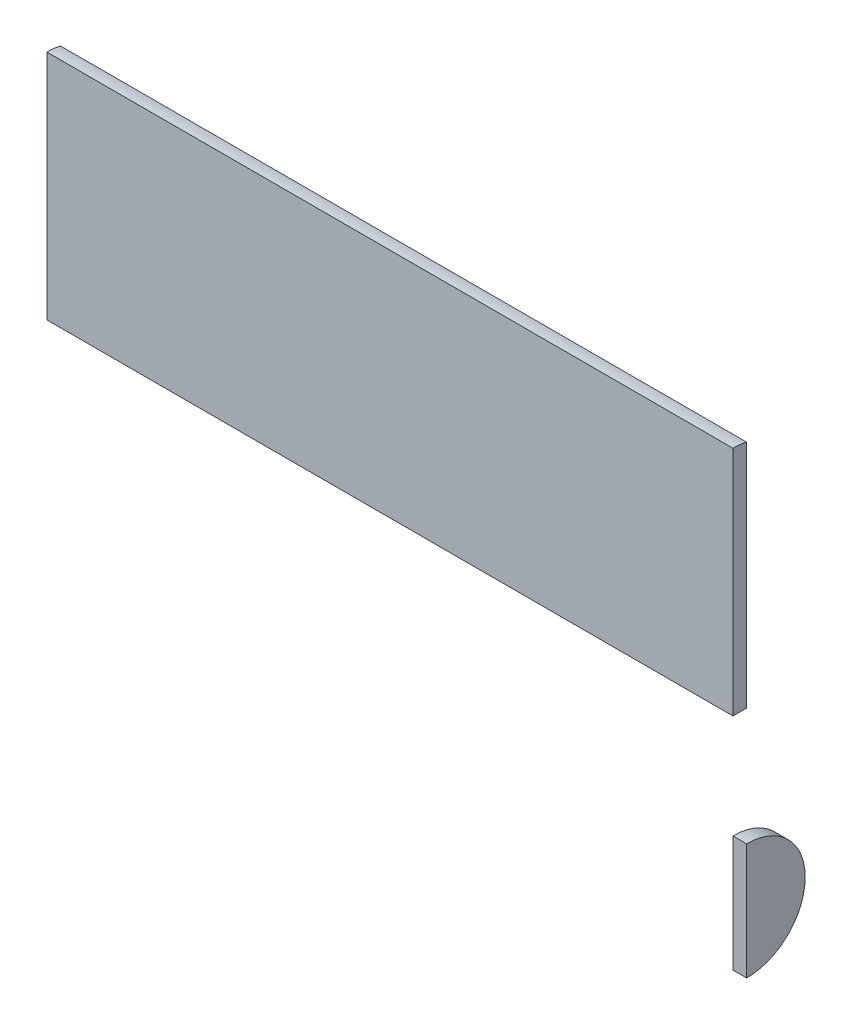
from build123d import *

# Parameters (mm, degrees)
BOSS_EXTRUDE1_DEPTH  = 3
BOSS_EXTRUDE3_DEPTH  = 150
BOSS_EXTRUDE11_DEPTH = 3


with BuildPart() as part:
    # Sketch2 → Boss-Extrude1 (new body)
    with BuildSketch(Plane.ZY.offset(8.88383994)):
        with BuildLine():
            Line((76.099311611, -4.056459865), (76.099311611, 21.335143292))
            ThreePointArc((76.099311611, 21.335143292), (63.30381, 8.639341714), (76.099311611, -4.056459865))
        make_face()
    extrude(amount=BOSS_EXTRUDE1_DEPTH)

    # Sketch9 → Boss-Extrude11 (add)
    with BuildSketch(Plane(origin=(-8.88383994, 0, 0), x_dir=(0, 0, -1), z_dir=(1, 0, 0))):
        with BuildLine():
            Line((-76.099311611, 12.448047164), (-76.099311611, 4.830636264))
            ThreePointArc((-76.099311611, 4.830636264), (-72.19, 8.639341714), (-76.099311611, 12.448047164))
        make_face()
    extrude(amount=-BOSS_EXTRUDE11_DEPTH)


with BuildPart() as body_2:
    # Sketch7 → Boss-Extrude3 (new body)
    with BuildSketch(Plane.ZY.offset(11.88383994)):
        with BuildLine():
            Line((76.099311611, 44.04950209), (73.099311611, 44.04950209))
            Line((73.099311611, 44.04950209), (73.099311611, 94.391344597))
            ThreePointArc((73.099311611, 94.391344597), (74.588552243, 94.660545999), (76.099311611, 94.74950209))
            Line((76.099311611, 94.74950209), (76.099311611, 44.04950209))
        make_face()
    extrude(amount=BOSS_EXTRUDE3_DEPTH)


solid = Compound([part.part, body_2.part])
